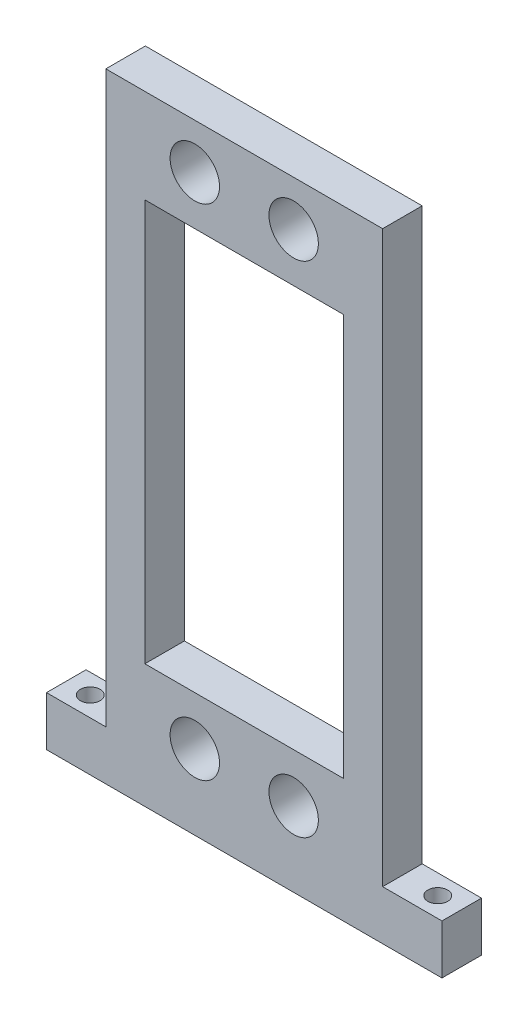
from build123d import *

# Parameters (mm, degrees)
BOSS_EXTRUDE1_DEPTH = 4
SKETCH2_R           = 2.5
CUT_EXTRUDE1_DEPTH  = 75.429628509
SKETCH3_R           = 1
CUT_EXTRUDE2_DEPTH  = 10
SKETCH4_W           = 20.1
SKETCH4_H           = 40.64
CUT_EXTRUDE6_DEPTH  = 10


with BuildPart() as part:
    # Sketch1 → Boss-Extrude1 (new body)
    with BuildSketch(Plane.XY):
        Polygon((0, 5), (6, 5), (6, 62.64), (34, 62.64), (34, 5), (40, 5), (40, 0), (0, 0), align=None)
    extrude(amount=BOSS_EXTRUDE1_DEPTH)

    # Sketch2 → Cut-Extrude1 (cut, through all)
    with BuildSketch(Plane.XY.offset(4)):
        with Locations((15, 7.57)):
            Circle(SKETCH2_R)
        with Locations((25, 7.57)):
            Circle(SKETCH2_R)
        with Locations((15, 58.07)):
            Circle(SKETCH2_R)
        with Locations((25, 58.07)):
            Circle(SKETCH2_R)
    extrude(amount=-CUT_EXTRUDE1_DEPTH, mode=Mode.SUBTRACT)

    # Sketch3 → Cut-Extrude2 (cut)
    with BuildSketch(Plane(origin=(0, 5, 0), x_dir=(1, 0, 0), z_dir=(0, 1, 0))):
        with Locations((2.424869657, -2)):
            Circle(SKETCH3_R)
        with Locations((37.575130343, -2)):
            Circle(SKETCH3_R)
    extrude(amount=-CUT_EXTRUDE2_DEPTH, mode=Mode.SUBTRACT)

    # Sketch4 → Cut-Extrude6 (cut)
    with BuildSketch(Plane.XY.offset(4)):
        with Locations((20, 32.82)):
            Rectangle(SKETCH4_W, SKETCH4_H)
    extrude(amount=-CUT_EXTRUDE6_DEPTH, mode=Mode.SUBTRACT)


solid = part.part
